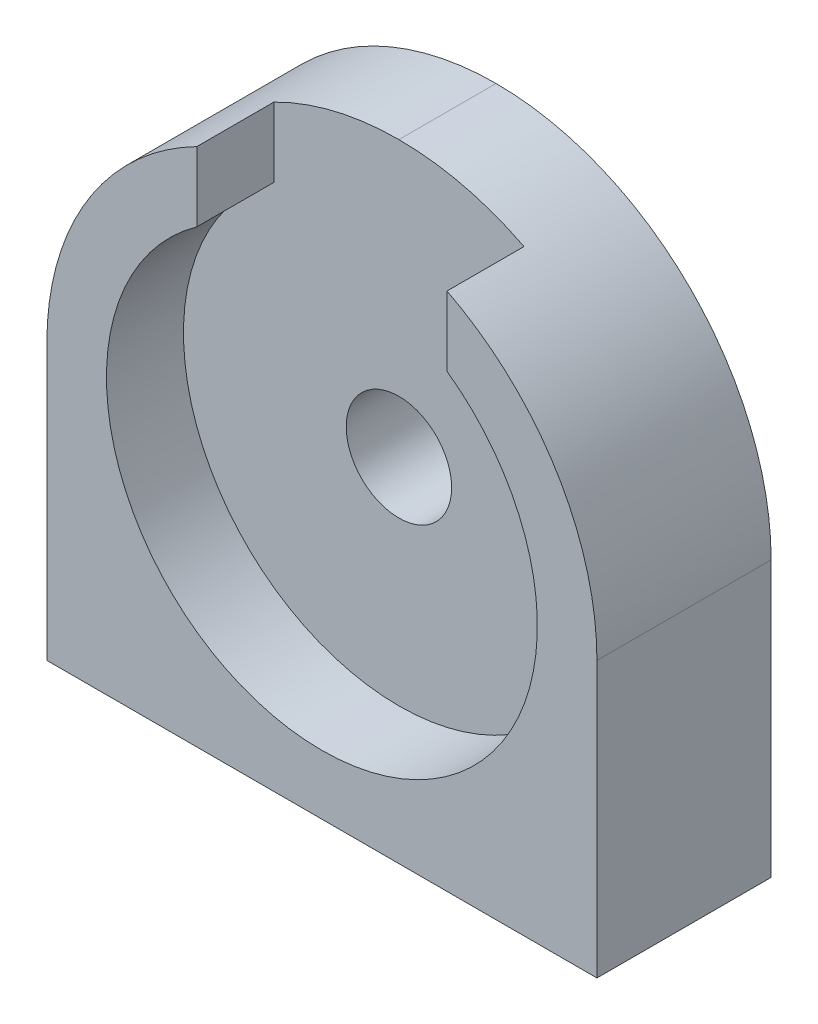
from build123d import *

# Parameters (mm, degrees)
SKETCH1_W           = 15.24
SKETCH1_H           = 15.24
BOSS_EXTRUDE1_DEPTH = 25.146
SKETCH2_R           = 5.969
CUT_EXTRUDE1_DEPTH  = 22.4536
FILLET1_R           = 7.62
CUT_EXTRUDE2_DEPTH  = 22.4536
SKETCH4_R           = 1.4605
CUT_EXTRUDE3_DEPTH  = 32.123614073
SKETCH6_W           = 16.374741922
SKETCH6_H           = 17.109502327
CUT_EXTRUDE5_DEPTH  = 20.32
SKETCH5_W           = 2.54
SKETCH5_H           = 2.54
CUT_EXTRUDE4_DEPTH  = 6.35


with BuildPart() as part:
    # Sketch1 → Boss-Extrude1 (new body)
    with BuildSketch(Plane.XY):
        with Locations((7.62, 7.62)):
            Rectangle(SKETCH1_W, SKETCH1_H)
    extrude(amount=BOSS_EXTRUDE1_DEPTH)

    # Sketch2 → Cut-Extrude1 (cut)
    with BuildSketch(Plane.XY.offset(25.146)):
        with Locations((7.62, 7.62)):
            Circle(SKETCH2_R)
    extrude(amount=-CUT_EXTRUDE1_DEPTH, mode=Mode.SUBTRACT)

    # Fillet1
    fillet1_edges = [part.edges().sort_by_distance(p)[0] for p in [
        (15.24, 15.24, 12.573),
        (0, 15.24, 12.573),
    ]]
    fillet(fillet1_edges, radius=FILLET1_R - 0.0001)  # a hair under: the kernel refuses the full size

    # Sketch3 → Cut-Extrude2 (cut)
    with BuildSketch(Plane.XY.offset(25.146)):
        with BuildLine():
            Line((11.085783791, 12.479763751), (11.085783791, 15.600426387))
            Line((11.085783791, 15.600426387), (4.154216209, 15.600426387))
            Line((4.154216209, 15.600426387), (4.154216209, 12.479763751))
            ThreePointArc((4.154216209, 12.479763751), (7.62, 13.589), (11.085783791, 12.479763751))
        make_face()
    extrude(amount=-CUT_EXTRUDE2_DEPTH, mode=Mode.SUBTRACT)

    # Sketch4 → Cut-Extrude3 (cut, through all)
    with BuildSketch(Plane.XY.offset(2.6924)):
        with Locations((7.62, 7.62)):
            Circle(SKETCH4_R)
    extrude(amount=-CUT_EXTRUDE3_DEPTH, mode=Mode.SUBTRACT)

    # Sketch6 → Cut-Extrude5 (cut)
    with BuildSketch(Plane.XY.offset(25.146)):
        with Locations((8.187370961, 8.554751164)):
            Rectangle(SKETCH6_W, SKETCH6_H)
    extrude(amount=-CUT_EXTRUDE5_DEPTH, mode=Mode.SUBTRACT)

    # Sketch5 → Cut-Extrude4 (cut)
    with BuildSketch(Plane.XY.offset(25.146)):
        with Locations((1.27, 1.27)):
            Rectangle(SKETCH5_W, SKETCH5_H)
        with Locations((13.97, 1.27)):
            Rectangle(SKETCH5_W, SKETCH5_H)
    extrude(amount=-CUT_EXTRUDE4_DEPTH, mode=Mode.SUBTRACT)


solid = part.part
